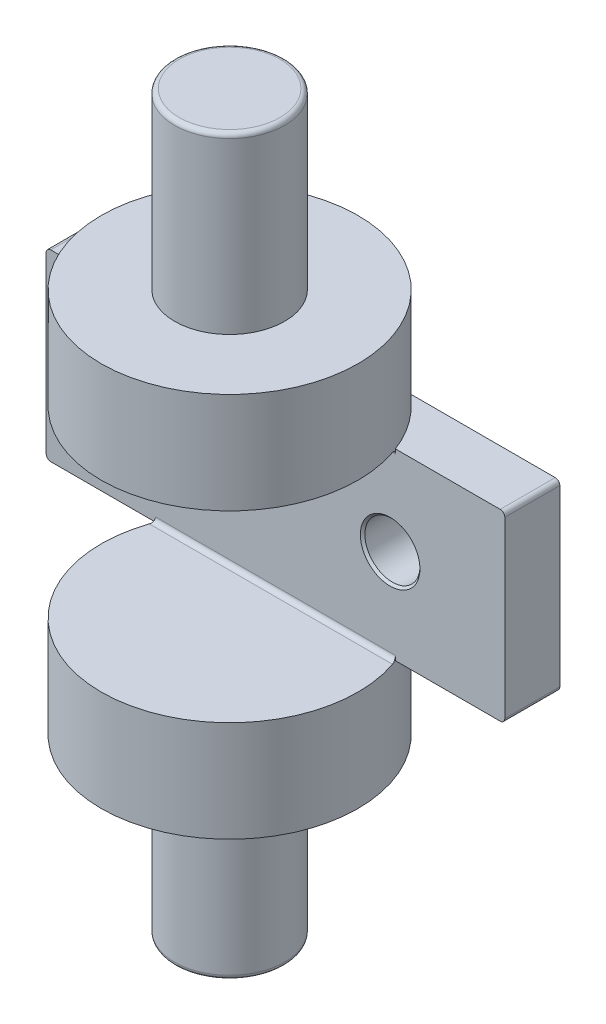
from build123d import *

# Parameters (mm, degrees)
CROQUIS1_R                 = 6
SALIENTE_EXTRUIR1_DEPTH    = 19
CROQUIS2_R                 = 14
SALIENTE_EXTRUIR2_DEPTH    = 11
CROQUIS5_W                 = 50
CROQUIS5_H                 = 6
SALIENTE_EXTRUIR6_DEPTH    = 20
CROQUIS6_R                 = 14
SALIENTE_EXTRUIR7_DEPTH    = 11
SALIENTE_EXTRUIR8_START    = 19
CROQUIS7_R                 = 6
SALIENTE_EXTRUIR8_DEPTH    = 19
CORTAR_EXTRUIR2_DEPTH      = 69.607579756
CORTAR_EXTRUIR2_DEPTH_BACK = 69.607579756
CROQUIS9_R                 = 3
REDONDEO2_R                = 0.5
CHAFL_N1_SIZE              = 0.25


with BuildPart() as part:
    # Croquis1 → Saliente-Extruir1 (new body)
    with BuildSketch(Plane(origin=(0, 0, 0), x_dir=(1, 0, 0), z_dir=(0, 1, 0))):
        with Locations(Location((0, 0, 0), (0, 0, 270))):
            Circle(CROQUIS1_R)
    extrude(amount=-SALIENTE_EXTRUIR1_DEPTH)

    # Croquis2 → Saliente-Extruir2 (add)
    with BuildSketch(Plane(origin=(0, 0, 0), x_dir=(1, 0, 0), z_dir=(0, 1, 0))):
        with Locations(Location((0, 0, 0), (0, 0, 270))):
            Circle(CROQUIS2_R)
    extrude(amount=SALIENTE_EXTRUIR2_DEPTH)

    # Croquis5 → Saliente-Extruir6 (add)
    with BuildSketch(Plane(origin=(0, 11, 0), x_dir=(1, 0, 0), z_dir=(0, 1, 0))):
        with Locations((0, 8)):
            Rectangle(CROQUIS5_W, CROQUIS5_H)
    extrude(amount=SALIENTE_EXTRUIR6_DEPTH)

    # Croquis6 → Saliente-Extruir7 (add)
    with BuildSketch(Plane(origin=(0, 31, 0), x_dir=(1, 0, 0), z_dir=(0, 1, 0))):
        with Locations(Location((0, 0, 0), (0, 0, 128.213210702))):
            Circle(CROQUIS6_R)
    extrude(amount=SALIENTE_EXTRUIR7_DEPTH)

    # Croquis7 → Saliente-Extruir8 (add)
    with BuildSketch(Plane(origin=(0, 42, 0), x_dir=(1, 0, 0), z_dir=(0, 1, 0)).offset(SALIENTE_EXTRUIR8_START)):
        with Locations(Location((0, 0, 0), (0, 0, 270))):
            Circle(CROQUIS7_R)
    extrude(amount=-SALIENTE_EXTRUIR8_DEPTH)

    # Croquis9 → Cortar-Extruir2 (cut, two sides: drawn at the far end of the back side and taken through both)
    with BuildSketch(Plane.XY.offset(-5).offset(-CORTAR_EXTRUIR2_DEPTH_BACK)):
        with Locations((-12.5, 21)):
            Circle(CROQUIS9_R)
        with Locations((12.5, 21)):
            Circle(CROQUIS9_R)
    extrude(amount=CORTAR_EXTRUIR2_DEPTH + CORTAR_EXTRUIR2_DEPTH_BACK, mode=Mode.SUBTRACT)

    # Redondeo2
    # the kernel refuses this fillet: 0.5 mm, written as the material it adds along each edge
    with BuildSketch(Plane(origin=(9.910254038, 11, -11), x_dir=(0, 0, -1), z_dir=(-1, 0, 0))) as redondeo2_piece_1_section:
        with BuildLine():
            CenterArc((REDONDEO2_R, -REDONDEO2_R), REDONDEO2_R, 90, 90)
            Line((0, -REDONDEO2_R), (0, 0))
            Line((0, 0), (REDONDEO2_R, 0))
        make_face()
    redondeo2_piece_1 = extrude(amount=19.820508076, mode=Mode.PRIVATE)
    redondeo2_piece_1 = redondeo2_piece_1 & Plane(origin=(0, 11.11248229, 0), x_dir=(0, 0, 1), z_dir=(0, -1, 0)) * Cylinder(14, 42, mode=Mode.PRIVATE)
    add(redondeo2_piece_1)
    with BuildSketch(Plane(origin=(-14.326696831, 11, -5), x_dir=(0, 0, 1), z_dir=(1, 0, 0))) as redondeo2_piece_2_section:
        with BuildLine():
            CenterArc((REDONDEO2_R, -REDONDEO2_R), REDONDEO2_R, 90, 90)
            Line((0, -REDONDEO2_R), (0, 0))
            Line((0, 0), (REDONDEO2_R, 0))
        make_face()
    redondeo2_piece_2 = extrude(amount=28.653393661, mode=Mode.PRIVATE)
    redondeo2_piece_2 = redondeo2_piece_2 & Plane(origin=(0, 11.111538065, 0), x_dir=(0, 0, 1), z_dir=(0, -1, 0)) * Cylinder(14, 60, mode=Mode.PRIVATE)
    add(redondeo2_piece_2)
    with BuildSketch(Plane(origin=(-14.326696831, 31, -5), x_dir=(0, -1, 0), z_dir=(1, 0, 0))) as redondeo2_piece_3_section:
        with BuildLine():
            CenterArc((REDONDEO2_R, -REDONDEO2_R), REDONDEO2_R, 90, 90)
            Line((0, -REDONDEO2_R), (0, 0))
            Line((0, 0), (REDONDEO2_R, 0))
        make_face()
    redondeo2_piece_3 = extrude(amount=28.653393661, mode=Mode.PRIVATE)
    redondeo2_piece_3 = redondeo2_piece_3 & Plane(origin=(0, 30.888461941, 0), x_dir=(-0.6185895741353322, 0, -0.7857142857114591), z_dir=(0, -1, 0)) * Cylinder(14, 60, mode=Mode.PRIVATE)
    add(redondeo2_piece_3)
    with BuildSketch(Plane(origin=(9.910254038, 31, -11), x_dir=(0, -1, 0), z_dir=(-1, 0, 0))) as redondeo2_piece_4_section:
        with BuildLine():
            CenterArc((REDONDEO2_R, -REDONDEO2_R), REDONDEO2_R, 90, 90)
            Line((0, -REDONDEO2_R), (0, 0))
            Line((0, 0), (REDONDEO2_R, 0))
        make_face()
    redondeo2_piece_4 = extrude(amount=19.820508076, mode=Mode.PRIVATE)
    redondeo2_piece_4 = redondeo2_piece_4 & Plane(origin=(0, 30.887517705, 0), x_dir=(-0.6185895741353322, 0, -0.7857142857114591), z_dir=(0, -1, 0)) * Cylinder(14, 42, mode=Mode.PRIVATE)
    add(redondeo2_piece_4)
    # the kernel refuses this fillet: 0.5 mm, written as the material it takes off along each edge
    with BuildSketch(Plane(origin=(0, -19, 0), x_dir=(0, 0, 1), z_dir=(-1, 0, 0))) as redondeo2_2_piece_1:
        with BuildLine():
            CenterArc((6 - REDONDEO2_R, REDONDEO2_R), REDONDEO2_R, 270, 90)
            Line((6 - REDONDEO2_R, 0), (6, 0))
            Line((6, 0), (6, REDONDEO2_R))
        make_face()
    revolve(axis=Axis((0, -19, 0), (0, 1, 0)), mode=Mode.SUBTRACT)
    with BuildSketch(Plane(origin=(0, 61, 0), x_dir=(0, 0, 1), z_dir=(-1, 0, 0))) as redondeo2_2_piece_2:
        with BuildLine():
            CenterArc((6 - REDONDEO2_R, -REDONDEO2_R), REDONDEO2_R, 0, 90)
            Line((6 - REDONDEO2_R, 0), (6, 0))
            Line((6, 0), (6, -REDONDEO2_R))
        make_face()
    revolve(axis=Axis((0, 61, 0), (0, 1, 0)), mode=Mode.SUBTRACT)
    with BuildSketch(Plane(origin=(25, 11, -3.75), x_dir=(-1, 0, 0), z_dir=(0, 0, -1)), Plane(origin=(25, 31, -3.75), x_dir=(0, -1, 0), z_dir=(0, 0, -1)), Plane(origin=(-25, 11, -12.25), x_dir=(1, 0, 0), z_dir=(0, 0, 1)), Plane(origin=(-25, 31, -12.25), x_dir=(0, -1, 0), z_dir=(0, 0, 1))) as redondeo2_2_piece_3:
        with BuildLine():
            CenterArc((REDONDEO2_R, REDONDEO2_R), REDONDEO2_R, 180, 90)
            Line((0, REDONDEO2_R), (0, 0))
            Line((0, 0), (REDONDEO2_R, 0))
        make_face()
    extrude(amount=8.5, mode=Mode.SUBTRACT)

    # Chaflán1
    chafl_n1_edges = [part.edges().sort_by_distance(p)[0] for p in [
        (-15.5, 21, -5),
        (9.5, 21, -5),
    ]]
    chamfer(chafl_n1_edges, length=CHAFL_N1_SIZE)


solid = part.part
